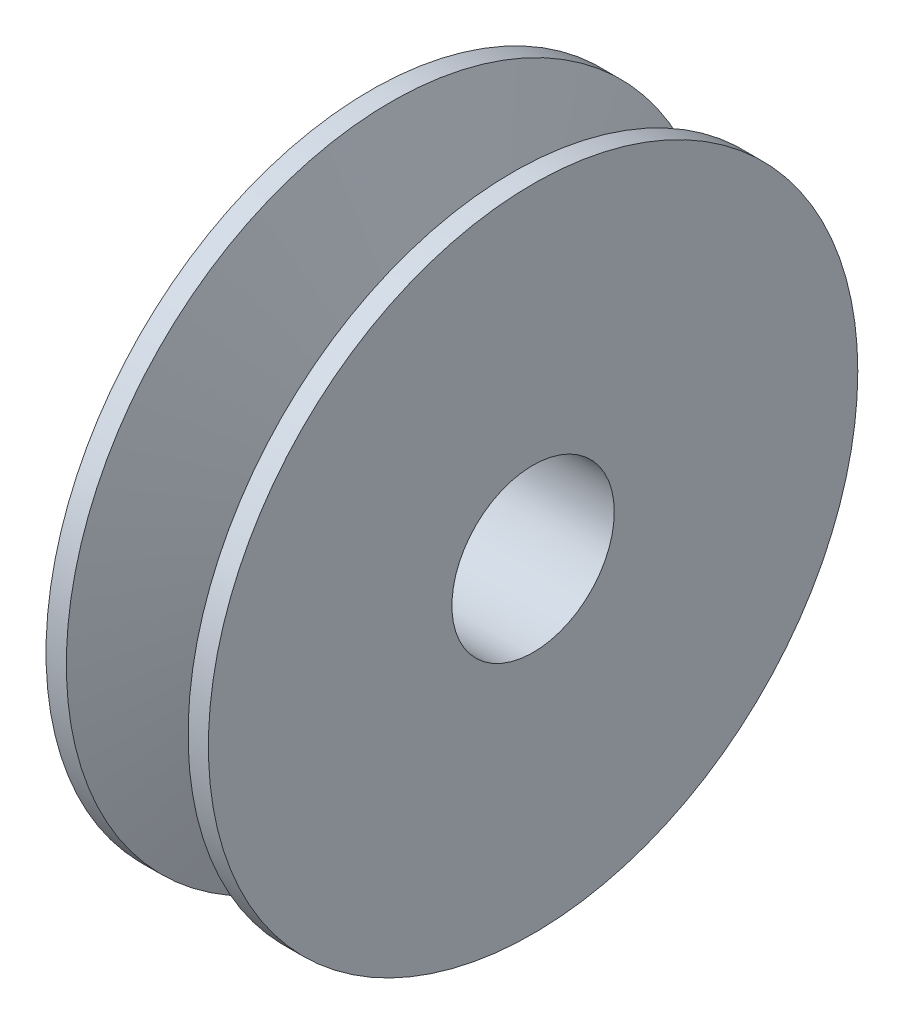
from build123d import *


with BuildPart() as part:
    # Sketch1 → Revolve1 (revolve)
    with BuildSketch(Plane.XY):
        Polygon((0, 12.7), (0, 50.8), (-3.175, 50.8), (-8.999169482, 31.75), (-16.400830518, 31.75), (-22.225, 50.8), (-25.4, 50.8), (-25.4, 12.7), align=None)
    revolve(axis=Axis((0, 0, 0), (-1, 0, 0)))


solid = part.part
